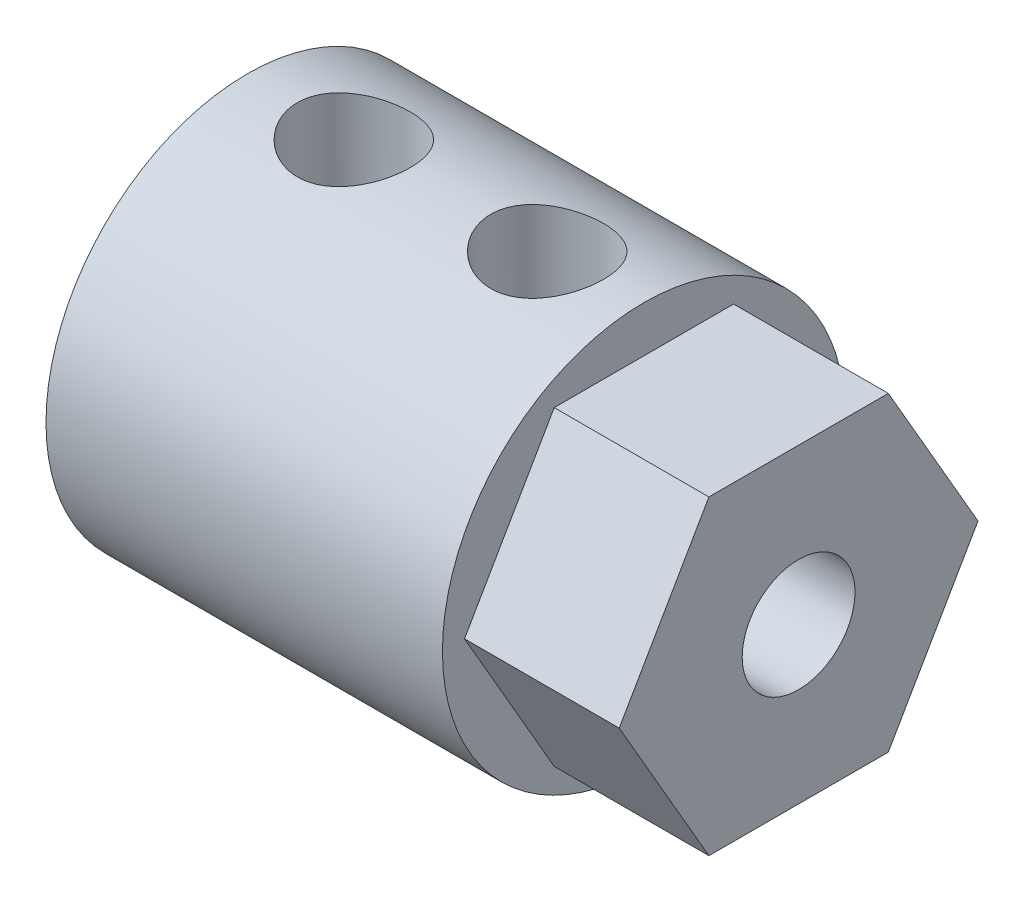
from build123d import *

# Parameters (mm, degrees)
HEX_2_DEPTH                = 6.096
SKETCH2_R                  = 7.9375
SKETCH2_R_2                = 3.2639
ROTARY_SHAFT_DEPTH         = 15.621
SKETCH3_R                  = 2.2225
SHAFT_SETSCREW_HOLES_DEPTH = 20.235993697
SKETCH4_R                  = 2.2225
CUT_EXTRUDE2_DEPTH         = 20.23599386


with BuildPart() as part:
    # Sketch1 → Hex 2 (new body)
    with BuildSketch(Plane(origin=(0, 0, 0), x_dir=(0, 0, -1), z_dir=(1, 0, 0))):
        Polygon((-3.534191938, 6.1214), (3.534191938, 6.1214), (7.068383876, 0), (3.534191938, -6.1214), (-3.534191938, -6.1214), (-7.068383876, 0), align=None)
    extrude(amount=HEX_2_DEPTH)

    # Sketch2 → Rotary_Shaft (add)
    with BuildSketch(Plane.ZY):
        Circle(SKETCH2_R)
        Circle(SKETCH2_R_2, mode=Mode.SUBTRACT)
    extrude(amount=ROTARY_SHAFT_DEPTH)

    # Sketch3 → Shaft-SetScrew-Holes (cut, through all)
    with BuildSketch(Plane(origin=(0, 0, 0), x_dir=(1, 0, 0), z_dir=(0, 1, 0))):
        with Locations((-11.43, 0)):
            Circle(SKETCH3_R)
        with Locations((-3.81, 0)):
            Circle(SKETCH3_R)
    extrude(amount=SHAFT_SETSCREW_HOLES_DEPTH, mode=Mode.SUBTRACT)

    # Sketch4 → Cut-Extrude2 (cut, through all)
    with BuildSketch(Plane.ZY):
        Circle(SKETCH4_R)
    extrude(amount=-CUT_EXTRUDE2_DEPTH, mode=Mode.SUBTRACT)


solid = part.part
